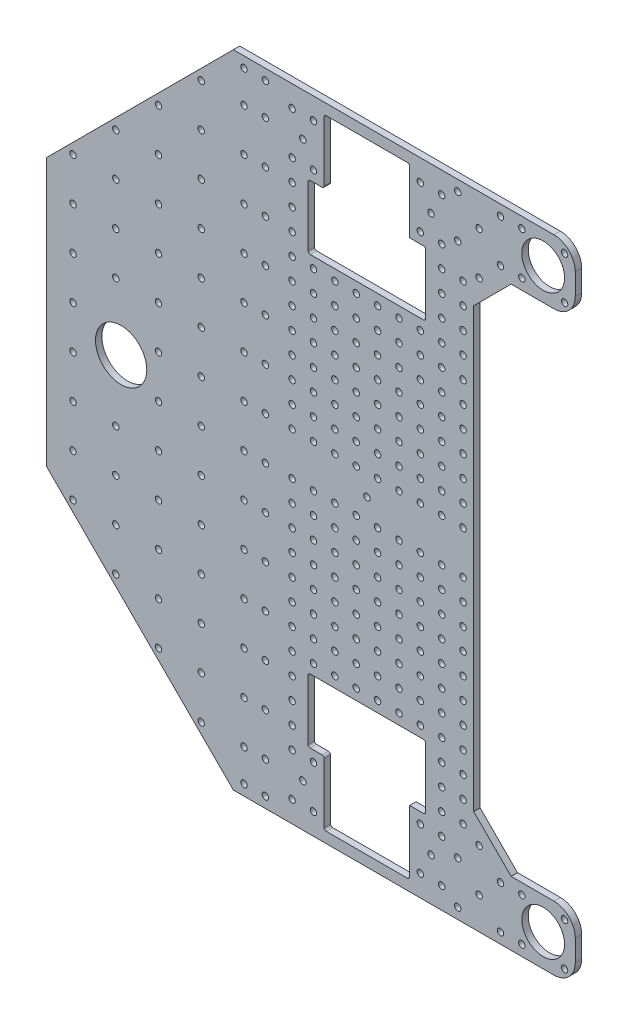
from build123d import *

# Parameters (mm, degrees)
SKETCH1_R                               = 1.5
MAIN_DEPTH                              = 3
SKETCH10_R                              = 1.5
MAINHOLES_DEPTH                         = 213.153246499
MOTORCODERLEFTHOLE_DEPTH                = 213.153246499
SKETCH8_R                               = 1.5
LINEARBALLFIXLEFT_DEPTH                 = 213.153246499
FILLET1_R                               = 1
SKETCH4_R                               = 1.5
BOTTOMLEFTHOLE_DEPTH                    = 213.153246499
LPATTERN1_COUNT                         = 5
LPATTERN1_PITCH                         = 20
SKETCH9_R                               = 1.5
CUT_EXTRUDE1_DEPTH                      = 213.153246499
BOTTOMLEFTHOLELPATTERN_COUNT            = 7
BOTTOMLEFTHOLELPATTERN_PITCH            = 20
BOTTOMLEFTHOLELPATTERN_COPY_1_SKETCH_R  = 1.5
BOTTOMLEFTHOLELPATTERN_COPY_1_DEPTH     = 213.153246499
BOTTOMLEFTHOLELPATTERN_COPY_2_SKETCH_R  = 1.5
BOTTOMLEFTHOLELPATTERN_COPY_2_DEPTH     = 213.153246499
BOTTOMLEFTHOLELPATTERN_COPY_3_SKETCH_R  = 1.5
BOTTOMLEFTHOLELPATTERN_COPY_3_DEPTH     = 213.153246499
BOTTOMLEFTHOLELPATTERN_COPY_4_SKETCH_R  = 1.5
BOTTOMLEFTHOLELPATTERN_COPY_4_DEPTH     = 213.153246499
BOTTOMLEFTHOLELPATTERN_COPY_5_SKETCH_R  = 1.5
BOTTOMLEFTHOLELPATTERN_COPY_5_DEPTH     = 213.153246499
BOTTOMLEFTHOLELPATTERN_COPY_6_SKETCH_R  = 1.5
BOTTOMLEFTHOLELPATTERN_COPY_6_DEPTH     = 213.153246499
BOTTOMLEFTHOLELPATTERN_COPY_7_SKETCH_R  = 1.5
BOTTOMLEFTHOLELPATTERN_COPY_7_DEPTH     = 213.153246499
BOTTOMLEFTHOLELPATTERN_COPY_8_SKETCH_R  = 1.5
BOTTOMLEFTHOLELPATTERN_COPY_8_DEPTH     = 213.153246499
BOTTOMLEFTHOLELPATTERN_COPY_9_SKETCH_R  = 1.5
BOTTOMLEFTHOLELPATTERN_COPY_9_DEPTH     = 213.153246499
BOTTOMLEFTHOLELPATTERN_COPY_10_SKETCH_R = 1.5
BOTTOMLEFTHOLELPATTERN_COPY_10_DEPTH    = 213.153246499
BOTTOMLEFTHOLELPATTERN_COPY_11_SKETCH_R = 1.5
BOTTOMLEFTHOLELPATTERN_COPY_11_DEPTH    = 213.153246499
BOTTOMLEFTHOLELPATTERN_COPY_12_SKETCH_R = 1.5
BOTTOMLEFTHOLELPATTERN_COPY_12_DEPTH    = 213.153246499
BOTTOMLEFTHOLELPATTERN_COPY_13_SKETCH_R = 1.5
BOTTOMLEFTHOLELPATTERN_COPY_13_DEPTH    = 213.153246499
BOTTOMLEFTHOLELPATTERN_COPY_14_SKETCH_R = 1.5
BOTTOMLEFTHOLELPATTERN_COPY_14_DEPTH    = 213.153246499
BOTTOMLEFTHOLELPATTERN_COPY_15_SKETCH_R = 1.5
BOTTOMLEFTHOLELPATTERN_COPY_15_DEPTH    = 213.153246499
BOTTOMLEFTHOLELPATTERN_COPY_16_SKETCH_R = 1.5
BOTTOMLEFTHOLELPATTERN_COPY_16_DEPTH    = 213.153246499
BOTTOMLEFTHOLELPATTERN_COPY_17_SKETCH_R = 1.5
BOTTOMLEFTHOLELPATTERN_COPY_17_DEPTH    = 213.153246499
BOTTOMLEFTHOLELPATTERN_COPY_18_SKETCH_R = 1.5
BOTTOMLEFTHOLELPATTERN_COPY_18_DEPTH    = 213.153246499
BOTTOMLEFTHOLELPATTERN_COPY_19_SKETCH_R = 1.5
BOTTOMLEFTHOLELPATTERN_COPY_19_DEPTH    = 213.153246499
BOTTOMLEFTHOLELPATTERN_COPY_20_SKETCH_R = 1.5
BOTTOMLEFTHOLELPATTERN_COPY_20_DEPTH    = 213.153246499
BOTTOMLEFTHOLELPATTERN_COPY_21_SKETCH_R = 1.5
BOTTOMLEFTHOLELPATTERN_COPY_21_DEPTH    = 213.153246499
BOTTOMLEFTHOLELPATTERN_COPY_22_SKETCH_R = 1.5
BOTTOMLEFTHOLELPATTERN_COPY_22_DEPTH    = 213.153246499
BOTTOMLEFTHOLELPATTERN_COPY_23_SKETCH_R = 1.5
BOTTOMLEFTHOLELPATTERN_COPY_23_DEPTH    = 213.153246499
BOTTOMLEFTHOLELPATTERN_COPY_24_SKETCH_R = 1.5
BOTTOMLEFTHOLELPATTERN_COPY_24_DEPTH    = 213.153246499
BOTTOMLEFTHOLELPATTERN_COPY_25_SKETCH_R = 1.5
BOTTOMLEFTHOLELPATTERN_COPY_25_DEPTH    = 213.153246499
BOTTOMLEFTHOLELPATTERN_COPY_26_SKETCH_R = 1.5
BOTTOMLEFTHOLELPATTERN_COPY_26_DEPTH    = 213.153246499
BOTTOMLEFTHOLELPATTERN_COPY_27_SKETCH_R = 1.5
BOTTOMLEFTHOLELPATTERN_COPY_27_DEPTH    = 213.153246499
BOTTOMLEFTHOLELPATTERN_COPY_28_SKETCH_R = 1.5
BOTTOMLEFTHOLELPATTERN_COPY_28_DEPTH    = 213.153246499
BOTTOMLEFTHOLELPATTERN_COPY_29_SKETCH_R = 1.5
BOTTOMLEFTHOLELPATTERN_COPY_29_DEPTH    = 213.153246499
BOTTOMLEFTHOLELPATTERN_COPY_30_SKETCH_R = 1.5
BOTTOMLEFTHOLELPATTERN_COPY_30_DEPTH    = 213.153246499
SKETCH7_R                               = 1.5
MOTORFIXHOLES_DEPTH                     = 213.153246499
MOTORFIXHOLELPATTERN_COUNT              = 11
MOTORFIXHOLELPATTERN_PITCH              = 10
SKETCH3_R                               = 12
SKETCH3_R_2                             = 10
BIGHOLES_DEPTH                          = 213.153246499
SKETCH5_R                               = 1.5
FRONTBALLSFIX_DEPTH                     = 213.153246499
MIRROR2_COPY_1_SKETCH_R                 = 1.5
MIRROR2_COPY_1_DEPTH                    = 213.153246499
MIRROR2_COPY_2_SKETCH_R                 = 1.5
MIRROR2_COPY_2_DEPTH                    = 213.153246499
MIRROR2_COPY_3_SKETCH_R                 = 1.5
MIRROR2_COPY_3_DEPTH                    = 213.153246499
MIRROR2_COPY_4_SKETCH_R                 = 1.5
MIRROR2_COPY_4_DEPTH                    = 213.153246499
MIRROR2_COPY_5_SKETCH_R                 = 1.5
MIRROR2_COPY_5_DEPTH                    = 213.153246499
MIRROR2_COPY_6_SKETCH_R                 = 1.5
MIRROR2_COPY_6_DEPTH                    = 213.153246499
MIRROR2_COPY_7_SKETCH_R                 = 1.5
MIRROR2_COPY_7_DEPTH                    = 213.153246499
MIRROR2_COPY_8_SKETCH_R                 = 1.5
MIRROR2_COPY_8_DEPTH                    = 213.153246499
MIRROR2_COPY_9_SKETCH_R                 = 1.5
MIRROR2_COPY_9_DEPTH                    = 213.153246499
MIRROR2_COPY_10_SKETCH_R                = 1.5
MIRROR2_COPY_10_DEPTH                   = 213.153246499
MIRROR2_COPY_11_SKETCH_R                = 1.5
MIRROR2_COPY_11_DEPTH                   = 213.153246499
MIRROR2_COPY_12_SKETCH_R                = 1.5
MIRROR2_COPY_12_DEPTH                   = 213.153246499
MIRROR2_COPY_13_SKETCH_R                = 1.5
MIRROR2_COPY_13_DEPTH                   = 213.153246499
MIRROR2_COPY_14_SKETCH_R                = 1.5
MIRROR2_COPY_14_DEPTH                   = 213.153246499
MIRROR2_COPY_15_SKETCH_R                = 1.5
MIRROR2_COPY_15_DEPTH                   = 213.153246499
MIRROR2_COPY_16_SKETCH_R                = 1.5
MIRROR2_COPY_16_DEPTH                   = 213.153246499
MIRROR2_COPY_17_SKETCH_R                = 1.5
MIRROR2_COPY_17_DEPTH                   = 213.153246499
MIRROR2_COPY_18_SKETCH_R                = 1.5
MIRROR2_COPY_18_DEPTH                   = 213.153246499
MIRROR2_COPY_19_SKETCH_R                = 1.5
MIRROR2_COPY_19_DEPTH                   = 213.153246499
MIRROR2_COPY_20_SKETCH_R                = 1.5
MIRROR2_COPY_20_DEPTH                   = 213.153246499
MIRROR2_COPY_21_SKETCH_R                = 1.5
MIRROR2_COPY_21_DEPTH                   = 213.153246499
MIRROR2_COPY_22_SKETCH_R                = 1.5
MIRROR2_COPY_22_DEPTH                   = 213.153246499
MIRROR2_COPY_23_SKETCH_R                = 1.5
MIRROR2_COPY_23_DEPTH                   = 213.153246499
MIRROR2_COPY_24_SKETCH_R                = 1.5
MIRROR2_COPY_24_DEPTH                   = 213.153246499
MIRROR2_COPY_25_SKETCH_R                = 1.5
MIRROR2_COPY_25_DEPTH                   = 213.153246499
MIRROR2_COPY_26_SKETCH_R                = 1.5
MIRROR2_COPY_26_DEPTH                   = 213.153246499
MIRROR2_COPY_27_SKETCH_R                = 1.5
MIRROR2_COPY_27_DEPTH                   = 213.153246499
MIRROR2_COPY_28_SKETCH_R                = 1.5
MIRROR2_COPY_28_DEPTH                   = 213.153246499
MIRROR2_COPY_29_SKETCH_R                = 1.5
MIRROR2_COPY_29_DEPTH                   = 213.153246499
MIRROR2_COPY_30_SKETCH_R                = 1.5
MIRROR2_COPY_30_DEPTH                   = 213.153246499
MIRROR2_COPY_31_SKETCH_R                = 1.5
MIRROR2_COPY_31_DEPTH                   = 213.153246499
MIRROR2_COPY_32_SKETCH_R                = 1.5
MIRROR2_COPY_32_DEPTH                   = 213.153246499
MIRROR2_COPY_33_SKETCH_R                = 1.5
MIRROR2_COPY_33_DEPTH                   = 213.153246499
MIRROR2_COPY_34_SKETCH_R                = 1.5
MIRROR2_COPY_34_DEPTH                   = 213.153246499
MIRROR2_COPY_35_SKETCH_R                = 1.5
MIRROR2_COPY_35_DEPTH                   = 213.153246499
MIRROR2_COPY_36_SKETCH_R                = 1.5
MIRROR2_COPY_36_DEPTH                   = 213.153246499
MIRROR2_COPY_37_SKETCH_R                = 1.5
MIRROR2_COPY_37_DEPTH                   = 213.153246499
MIRROR2_COPY_38_SKETCH_R                = 1.5
MIRROR2_COPY_38_DEPTH                   = 213.153246499
MIRROR2_COPY_39_SKETCH_R                = 1.5
MIRROR2_COPY_39_DEPTH                   = 213.153246499
MIRROR2_COPY_40_SKETCH_R                = 1.5
MIRROR2_COPY_40_DEPTH                   = 213.153246499
MIRROR2_COPY_41_SKETCH_R                = 1.5
MIRROR2_COPY_41_DEPTH                   = 213.153246499
MIRROR2_COPY_42_SKETCH_R                = 1.5
MIRROR2_COPY_42_DEPTH                   = 213.153246499
MIRROR2_COPY_43_SKETCH_R                = 1.5
MIRROR2_COPY_43_DEPTH                   = 213.153246499
MIRROR2_COPY_44_SKETCH_R                = 1.5
MIRROR2_COPY_44_DEPTH                   = 213.153246499
MIRROR2_COPY_45_SKETCH_R                = 1.5
MIRROR2_COPY_45_DEPTH                   = 213.153246499
MIRROR2_COPY_46_SKETCH_R                = 1.5
MIRROR2_COPY_46_DEPTH                   = 213.153246499
MIRROR2_COPY_47_SKETCH_R                = 1.5
MIRROR2_COPY_47_DEPTH                   = 213.153246499
MIRROR2_COPY_48_SKETCH_R                = 1.5
MIRROR2_COPY_48_DEPTH                   = 213.153246499
MIRROR2_COPY_49_SKETCH_R                = 1.5
MIRROR2_COPY_49_DEPTH                   = 213.153246499
MIRROR2_COPY_50_SKETCH_R                = 1.5
MIRROR2_COPY_50_DEPTH                   = 213.153246499
MIRROR2_COPY_51_SKETCH_R                = 1.5
MIRROR2_COPY_51_DEPTH                   = 213.153246499
FILLET1_OF_MIRROR2_R                    = 1


with BuildPart() as part:
    # Sketch1 → Main (new body)
    with BuildSketch(Plane.XY):
        with BuildLine():
            Line((-150, 62.5), (-150, -62.5))
            Line((-150, -62.5), (-62.5, -150))
            Line((-62.5, -150), (87.5, -150))
            ThreePointArc((87.5, -150), (94.571067812, -147.071067812), (97.5, -140))
            Line((97.5, -140), (97.5, -130))
            ThreePointArc((97.5, -130), (94.571067812, -122.928932188), (87.5, -120))
            Line((87.5, -120), (67.5, -120))
            Line((67.5, -120), (50, -102.5))
            Line((50, -102.5), (50, 102.5))
            Line((50, 102.5), (67.5, 120))
            Line((67.5, 120), (87.5, 120))
            ThreePointArc((87.5, 120), (94.571067812, 122.928932188), (97.5, 130))
            Line((97.5, 130), (97.5, 140))
            ThreePointArc((97.5, 140), (94.571067812, 147.071067812), (87.5, 150))
            Line((87.5, 150), (-62.5, 150))
            Line((-62.5, 150), (-150, 62.5))
        make_face()
        Circle(SKETCH1_R, mode=Mode.SUBTRACT)
    extrude(amount=MAIN_DEPTH)

    # Sketch10 → MainHoles (cut, through all)
    with BuildSketch(Plane.XY.offset(3)):
        with Locations((-57.5, 145)):
            Circle(SKETCH10_R)
        with Locations((-47.5, 145)):
            Circle(SKETCH10_R)
        with Locations((62.5, 145)):
            Circle(SKETCH10_R)
        with Locations((62.5, 125)):
            Circle(SKETCH10_R)
        with Locations((42.5, 145)):
            Circle(SKETCH10_R)
        with Locations((42.5, 125)):
            Circle(SKETCH10_R)
        with Locations((52.5, 135)):
            Circle(SKETCH10_R)
        with Locations((52.5, 115)):
            Circle(SKETCH10_R)
    mainholes = extrude(amount=-MAINHOLES_DEPTH, mode=Mode.SUBTRACT)

    # Sketch2 → MotorCoderLeftHole (cut, through all)
    with BuildSketch(Plane.XY.offset(3)):
        Polygon((-27.5, 115), (-27.5, 85), (27.5, 85), (27.5, 115), (20, 115), (20, 145), (-20, 145), (-20, 115), align=None)
    motorcoderlefthole = extrude(amount=-MOTORCODERLEFTHOLE_DEPTH, mode=Mode.SUBTRACT)

    # Sketch8 → LinearBallFixLeft (cut, through all)
    with BuildSketch(Plane.XY.offset(3)):
        with Locations((-30, 130)):
            Circle(SKETCH8_R)
        with Locations((-35, 120)):
            Circle(SKETCH8_R)
        with Locations((-25, 120)):
            Circle(SKETCH8_R)
        with Locations((-35, 140)):
            Circle(SKETCH8_R)
        with Locations((-25, 140)):
            Circle(SKETCH8_R)
    linearballfixleft = extrude(amount=-LINEARBALLFIXLEFT_DEPTH, mode=Mode.SUBTRACT)

    # LinearBallFixLeftMirror: LinearBallFixLeft across plane
    add(linearballfixleft.mirror(Plane(origin=(0, 0, 0), x_dir=(0, 0, 1), z_dir=(1, 0, 0))), mode=Mode.SUBTRACT)

    # Fillet1
    fillet1_edges = [part.edges().sort_by_distance(p)[0] for p in [
        (-20, 145, 1.5),
        (27.5, 115, 1.5),
        (20, 145, 1.5),
        (-20, 115, 1.5),
        (-27.5, 115, 1.5),
        (27.5, 85, 1.5),
        (-27.5, 85, 1.5),
    ]]
    fillet(fillet1_edges, radius=FILLET1_R)

    # Sketch4 → BottomLeftHole (cut, through all)
    with BuildSketch(Plane.XY.offset(3)):
        with Locations((-57.5, 10)):
            Circle(SKETCH4_R)
    bottomlefthole = extrude(amount=-BOTTOMLEFTHOLE_DEPTH, mode=Mode.SUBTRACT)

    # LPattern1: BottomLeftHole ×5
    with Locations(*[(-i * LPATTERN1_PITCH, 0, 0) for i in range(1, LPATTERN1_COUNT)]):
        add(bottomlefthole, mode=Mode.SUBTRACT)

    # Sketch9 → Cut-Extrude1 (cut, through all)
    with BuildSketch(Plane.XY.offset(3)):
        with Locations((-47.5, 10)):
            Circle(SKETCH9_R)
    cut_extrude1 = extrude(amount=-CUT_EXTRUDE1_DEPTH, mode=Mode.SUBTRACT)

    # BottomLeftHoleLPattern: Cut-Extrude1 ×7
    with Locations(*[(0, i * BOTTOMLEFTHOLELPATTERN_PITCH, 0) for i in range(1, BOTTOMLEFTHOLELPATTERN_COUNT)]):
        add(cut_extrude1, mode=Mode.SUBTRACT)

    # BottomLeftHoleLPattern copy 1 sketch → BottomLeftHoleLPattern copy 1 (cut, through all)
    with BuildSketch(Plane(origin=(-20, 20, 3), x_dir=(1, 0, 0), z_dir=(0, 0, 1))):
        with Locations((-57.5, 10)):
            Circle(BOTTOMLEFTHOLELPATTERN_COPY_1_SKETCH_R)
    extrude(amount=-BOTTOMLEFTHOLELPATTERN_COPY_1_DEPTH, mode=Mode.SUBTRACT)

    # BottomLeftHoleLPattern copy 2 sketch → BottomLeftHoleLPattern copy 2 (cut, through all)
    with BuildSketch(Plane(origin=(-20, 40, 3), x_dir=(1, 0, 0), z_dir=(0, 0, 1))):
        with Locations((-57.5, 10)):
            Circle(BOTTOMLEFTHOLELPATTERN_COPY_2_SKETCH_R)
    extrude(amount=-BOTTOMLEFTHOLELPATTERN_COPY_2_DEPTH, mode=Mode.SUBTRACT)

    # BottomLeftHoleLPattern copy 3 sketch → BottomLeftHoleLPattern copy 3 (cut, through all)
    with BuildSketch(Plane(origin=(-20, 60, 3), x_dir=(1, 0, 0), z_dir=(0, 0, 1))):
        with Locations((-57.5, 10)):
            Circle(BOTTOMLEFTHOLELPATTERN_COPY_3_SKETCH_R)
    extrude(amount=-BOTTOMLEFTHOLELPATTERN_COPY_3_DEPTH, mode=Mode.SUBTRACT)

    # BottomLeftHoleLPattern copy 4 sketch → BottomLeftHoleLPattern copy 4 (cut, through all)
    with BuildSketch(Plane(origin=(-20, 80, 3), x_dir=(1, 0, 0), z_dir=(0, 0, 1))):
        with Locations((-57.5, 10)):
            Circle(BOTTOMLEFTHOLELPATTERN_COPY_4_SKETCH_R)
    extrude(amount=-BOTTOMLEFTHOLELPATTERN_COPY_4_DEPTH, mode=Mode.SUBTRACT)

    # BottomLeftHoleLPattern copy 5 sketch → BottomLeftHoleLPattern copy 5 (cut, through all)
    with BuildSketch(Plane(origin=(-20, 100, 3), x_dir=(1, 0, 0), z_dir=(0, 0, 1))):
        with Locations((-57.5, 10)):
            Circle(BOTTOMLEFTHOLELPATTERN_COPY_5_SKETCH_R)
    extrude(amount=-BOTTOMLEFTHOLELPATTERN_COPY_5_DEPTH, mode=Mode.SUBTRACT)

    # BottomLeftHoleLPattern copy 6 sketch → BottomLeftHoleLPattern copy 6 (cut, through all)
    with BuildSketch(Plane(origin=(-20, 120, 3), x_dir=(1, 0, 0), z_dir=(0, 0, 1))):
        with Locations((-57.5, 10)):
            Circle(BOTTOMLEFTHOLELPATTERN_COPY_6_SKETCH_R)
    extrude(amount=-BOTTOMLEFTHOLELPATTERN_COPY_6_DEPTH, mode=Mode.SUBTRACT)

    # BottomLeftHoleLPattern copy 7 sketch → BottomLeftHoleLPattern copy 7 (cut, through all)
    with BuildSketch(Plane(origin=(-40, 20, 3), x_dir=(1, 0, 0), z_dir=(0, 0, 1))):
        with Locations((-57.5, 10)):
            Circle(BOTTOMLEFTHOLELPATTERN_COPY_7_SKETCH_R)
    extrude(amount=-BOTTOMLEFTHOLELPATTERN_COPY_7_DEPTH, mode=Mode.SUBTRACT)

    # BottomLeftHoleLPattern copy 8 sketch → BottomLeftHoleLPattern copy 8 (cut, through all)
    with BuildSketch(Plane(origin=(-40, 40, 3), x_dir=(1, 0, 0), z_dir=(0, 0, 1))):
        with Locations((-57.5, 10)):
            Circle(BOTTOMLEFTHOLELPATTERN_COPY_8_SKETCH_R)
    extrude(amount=-BOTTOMLEFTHOLELPATTERN_COPY_8_DEPTH, mode=Mode.SUBTRACT)

    # BottomLeftHoleLPattern copy 9 sketch → BottomLeftHoleLPattern copy 9 (cut, through all)
    with BuildSketch(Plane(origin=(-40, 60, 3), x_dir=(1, 0, 0), z_dir=(0, 0, 1))):
        with Locations((-57.5, 10)):
            Circle(BOTTOMLEFTHOLELPATTERN_COPY_9_SKETCH_R)
    extrude(amount=-BOTTOMLEFTHOLELPATTERN_COPY_9_DEPTH, mode=Mode.SUBTRACT)

    # BottomLeftHoleLPattern copy 10 sketch → BottomLeftHoleLPattern copy 10 (cut, through all)
    with BuildSketch(Plane(origin=(-40, 80, 3), x_dir=(1, 0, 0), z_dir=(0, 0, 1))):
        with Locations((-57.5, 10)):
            Circle(BOTTOMLEFTHOLELPATTERN_COPY_10_SKETCH_R)
    extrude(amount=-BOTTOMLEFTHOLELPATTERN_COPY_10_DEPTH, mode=Mode.SUBTRACT)

    # BottomLeftHoleLPattern copy 11 sketch → BottomLeftHoleLPattern copy 11 (cut, through all)
    with BuildSketch(Plane(origin=(-40, 100, 3), x_dir=(1, 0, 0), z_dir=(0, 0, 1))):
        with Locations((-57.5, 10)):
            Circle(BOTTOMLEFTHOLELPATTERN_COPY_11_SKETCH_R)
    extrude(amount=-BOTTOMLEFTHOLELPATTERN_COPY_11_DEPTH, mode=Mode.SUBTRACT)

    # BottomLeftHoleLPattern copy 12 sketch → BottomLeftHoleLPattern copy 12 (cut, through all)
    with BuildSketch(Plane(origin=(-40, 120, 3), x_dir=(1, 0, 0), z_dir=(0, 0, 1))):
        with Locations((-57.5, 10)):
            Circle(BOTTOMLEFTHOLELPATTERN_COPY_12_SKETCH_R)
    extrude(amount=-BOTTOMLEFTHOLELPATTERN_COPY_12_DEPTH, mode=Mode.SUBTRACT)

    # BottomLeftHoleLPattern copy 13 sketch → BottomLeftHoleLPattern copy 13 (cut, through all)
    with BuildSketch(Plane(origin=(-60, 20, 3), x_dir=(1, 0, 0), z_dir=(0, 0, 1))):
        with Locations((-57.5, 10)):
            Circle(BOTTOMLEFTHOLELPATTERN_COPY_13_SKETCH_R)
    extrude(amount=-BOTTOMLEFTHOLELPATTERN_COPY_13_DEPTH, mode=Mode.SUBTRACT)

    # BottomLeftHoleLPattern copy 14 sketch → BottomLeftHoleLPattern copy 14 (cut, through all)
    with BuildSketch(Plane(origin=(-60, 40, 3), x_dir=(1, 0, 0), z_dir=(0, 0, 1))):
        with Locations((-57.5, 10)):
            Circle(BOTTOMLEFTHOLELPATTERN_COPY_14_SKETCH_R)
    extrude(amount=-BOTTOMLEFTHOLELPATTERN_COPY_14_DEPTH, mode=Mode.SUBTRACT)

    # BottomLeftHoleLPattern copy 15 sketch → BottomLeftHoleLPattern copy 15 (cut, through all)
    with BuildSketch(Plane(origin=(-60, 60, 3), x_dir=(1, 0, 0), z_dir=(0, 0, 1))):
        with Locations((-57.5, 10)):
            Circle(BOTTOMLEFTHOLELPATTERN_COPY_15_SKETCH_R)
    extrude(amount=-BOTTOMLEFTHOLELPATTERN_COPY_15_DEPTH, mode=Mode.SUBTRACT)

    # BottomLeftHoleLPattern copy 16 sketch → BottomLeftHoleLPattern copy 16 (cut, through all)
    with BuildSketch(Plane(origin=(-60, 80, 3), x_dir=(1, 0, 0), z_dir=(0, 0, 1))):
        with Locations((-57.5, 10)):
            Circle(BOTTOMLEFTHOLELPATTERN_COPY_16_SKETCH_R)
    extrude(amount=-BOTTOMLEFTHOLELPATTERN_COPY_16_DEPTH, mode=Mode.SUBTRACT)

    # BottomLeftHoleLPattern copy 17 sketch → BottomLeftHoleLPattern copy 17 (cut, through all)
    with BuildSketch(Plane(origin=(-60, 100, 3), x_dir=(1, 0, 0), z_dir=(0, 0, 1))):
        with Locations((-57.5, 10)):
            Circle(BOTTOMLEFTHOLELPATTERN_COPY_17_SKETCH_R)
    extrude(amount=-BOTTOMLEFTHOLELPATTERN_COPY_17_DEPTH, mode=Mode.SUBTRACT)

    # BottomLeftHoleLPattern copy 18 sketch → BottomLeftHoleLPattern copy 18 (cut, through all)
    with BuildSketch(Plane(origin=(-60, 120, 3), x_dir=(1, 0, 0), z_dir=(0, 0, 1))):
        with Locations((-57.5, 10)):
            Circle(BOTTOMLEFTHOLELPATTERN_COPY_18_SKETCH_R)
    extrude(amount=-BOTTOMLEFTHOLELPATTERN_COPY_18_DEPTH, mode=Mode.SUBTRACT)

    # BottomLeftHoleLPattern copy 19 sketch → BottomLeftHoleLPattern copy 19 (cut, through all)
    with BuildSketch(Plane(origin=(-80, 20, 3), x_dir=(1, 0, 0), z_dir=(0, 0, 1))):
        with Locations((-57.5, 10)):
            Circle(BOTTOMLEFTHOLELPATTERN_COPY_19_SKETCH_R)
    extrude(amount=-BOTTOMLEFTHOLELPATTERN_COPY_19_DEPTH, mode=Mode.SUBTRACT)

    # BottomLeftHoleLPattern copy 20 sketch → BottomLeftHoleLPattern copy 20 (cut, through all)
    with BuildSketch(Plane(origin=(-80, 40, 3), x_dir=(1, 0, 0), z_dir=(0, 0, 1))):
        with Locations((-57.5, 10)):
            Circle(BOTTOMLEFTHOLELPATTERN_COPY_20_SKETCH_R)
    extrude(amount=-BOTTOMLEFTHOLELPATTERN_COPY_20_DEPTH, mode=Mode.SUBTRACT)

    # BottomLeftHoleLPattern copy 21 sketch → BottomLeftHoleLPattern copy 21 (cut, through all)
    with BuildSketch(Plane(origin=(-80, 60, 3), x_dir=(1, 0, 0), z_dir=(0, 0, 1))):
        with Locations((-57.5, 10)):
            Circle(BOTTOMLEFTHOLELPATTERN_COPY_21_SKETCH_R)
    extrude(amount=-BOTTOMLEFTHOLELPATTERN_COPY_21_DEPTH, mode=Mode.SUBTRACT)

    # BottomLeftHoleLPattern copy 22 sketch → BottomLeftHoleLPattern copy 22 (cut, through all)
    with BuildSketch(Plane(origin=(-80, 80, 3), x_dir=(1, 0, 0), z_dir=(0, 0, 1))):
        with Locations((-57.5, 10)):
            Circle(BOTTOMLEFTHOLELPATTERN_COPY_22_SKETCH_R)
    extrude(amount=-BOTTOMLEFTHOLELPATTERN_COPY_22_DEPTH, mode=Mode.SUBTRACT)

    # BottomLeftHoleLPattern copy 23 sketch → BottomLeftHoleLPattern copy 23 (cut, through all)
    with BuildSketch(Plane(origin=(-80, 100, 3), x_dir=(1, 0, 0), z_dir=(0, 0, 1))):
        with Locations((-57.5, 10)):
            Circle(BOTTOMLEFTHOLELPATTERN_COPY_23_SKETCH_R)
    extrude(amount=-BOTTOMLEFTHOLELPATTERN_COPY_23_DEPTH, mode=Mode.SUBTRACT)

    # BottomLeftHoleLPattern copy 24 sketch → BottomLeftHoleLPattern copy 24 (cut, through all)
    with BuildSketch(Plane(origin=(-80, 120, 3), x_dir=(1, 0, 0), z_dir=(0, 0, 1))):
        with Locations((-57.5, 10)):
            Circle(BOTTOMLEFTHOLELPATTERN_COPY_24_SKETCH_R)
    extrude(amount=-BOTTOMLEFTHOLELPATTERN_COPY_24_DEPTH, mode=Mode.SUBTRACT)

    # BottomLeftHoleLPattern copy 25 sketch → BottomLeftHoleLPattern copy 25 (cut, through all)
    with BuildSketch(Plane(origin=(0, 20, 3), x_dir=(1, 0, 0), z_dir=(0, 0, 1))):
        with Locations((-57.5, 10)):
            Circle(BOTTOMLEFTHOLELPATTERN_COPY_25_SKETCH_R)
    extrude(amount=-BOTTOMLEFTHOLELPATTERN_COPY_25_DEPTH, mode=Mode.SUBTRACT)

    # BottomLeftHoleLPattern copy 26 sketch → BottomLeftHoleLPattern copy 26 (cut, through all)
    with BuildSketch(Plane(origin=(0, 40, 3), x_dir=(1, 0, 0), z_dir=(0, 0, 1))):
        with Locations((-57.5, 10)):
            Circle(BOTTOMLEFTHOLELPATTERN_COPY_26_SKETCH_R)
    extrude(amount=-BOTTOMLEFTHOLELPATTERN_COPY_26_DEPTH, mode=Mode.SUBTRACT)

    # BottomLeftHoleLPattern copy 27 sketch → BottomLeftHoleLPattern copy 27 (cut, through all)
    with BuildSketch(Plane(origin=(0, 60, 3), x_dir=(1, 0, 0), z_dir=(0, 0, 1))):
        with Locations((-57.5, 10)):
            Circle(BOTTOMLEFTHOLELPATTERN_COPY_27_SKETCH_R)
    extrude(amount=-BOTTOMLEFTHOLELPATTERN_COPY_27_DEPTH, mode=Mode.SUBTRACT)

    # BottomLeftHoleLPattern copy 28 sketch → BottomLeftHoleLPattern copy 28 (cut, through all)
    with BuildSketch(Plane(origin=(0, 80, 3), x_dir=(1, 0, 0), z_dir=(0, 0, 1))):
        with Locations((-57.5, 10)):
            Circle(BOTTOMLEFTHOLELPATTERN_COPY_28_SKETCH_R)
    extrude(amount=-BOTTOMLEFTHOLELPATTERN_COPY_28_DEPTH, mode=Mode.SUBTRACT)

    # BottomLeftHoleLPattern copy 29 sketch → BottomLeftHoleLPattern copy 29 (cut, through all)
    with BuildSketch(Plane(origin=(0, 100, 3), x_dir=(1, 0, 0), z_dir=(0, 0, 1))):
        with Locations((-57.5, 10)):
            Circle(BOTTOMLEFTHOLELPATTERN_COPY_29_SKETCH_R)
    extrude(amount=-BOTTOMLEFTHOLELPATTERN_COPY_29_DEPTH, mode=Mode.SUBTRACT)

    # BottomLeftHoleLPattern copy 30 sketch → BottomLeftHoleLPattern copy 30 (cut, through all)
    with BuildSketch(Plane(origin=(0, 120, 3), x_dir=(1, 0, 0), z_dir=(0, 0, 1))):
        with Locations((-57.5, 10)):
            Circle(BOTTOMLEFTHOLELPATTERN_COPY_30_SKETCH_R)
    extrude(amount=-BOTTOMLEFTHOLELPATTERN_COPY_30_DEPTH, mode=Mode.SUBTRACT)

    # Sketch7 → MotorFixHoles (cut, through all)
    with BuildSketch(Plane.XY.offset(3)):
        with Locations((-5, 10)):
            Circle(SKETCH7_R)
        with Locations((-15, 10)):
            Circle(SKETCH7_R)
        with Locations((5, 10)):
            Circle(SKETCH7_R)
        with Locations((-25, 10)):
            Circle(SKETCH7_R)
        with Locations((15, 10)):
            Circle(SKETCH7_R)
        with Locations((-35, 10)):
            Circle(SKETCH7_R)
        with Locations((25, 10)):
            Circle(SKETCH7_R)
        with Locations((45, 10)):
            Circle(SKETCH7_R)
        with Locations((35, 10)):
            Circle(SKETCH7_R)
    motorfixholes = extrude(amount=-MOTORFIXHOLES_DEPTH, mode=Mode.SUBTRACT)

    # MotorFixHoleLPattern: MotorFixHoles ×11
    with Locations(*[(0, i * MOTORFIXHOLELPATTERN_PITCH, 0) for i in range(1, MOTORFIXHOLELPATTERN_COUNT)]):
        add(motorfixholes, mode=Mode.SUBTRACT)

    # Sketch3 → BigHoles (cut, through all)
    with BuildSketch(Plane.XY.offset(3)):
        with Locations((-115, 0)):
            Circle(SKETCH3_R)
        with Locations((82.5, 135)):
            Circle(SKETCH3_R_2)
        with Locations((82.5, -135)):
            Circle(SKETCH3_R_2)
    bigholes = extrude(amount=-BIGHOLES_DEPTH, mode=Mode.SUBTRACT)

    # Sketch5 → FrontBallsFix (cut, through all)
    with BuildSketch(Plane.XY.offset(3)):
        with Locations((72.5, 125)):
            Circle(SKETCH5_R)
        with Locations((92.5, 125)):
            Circle(SKETCH5_R)
        with Locations((72.5, 145)):
            Circle(SKETCH5_R)
        with Locations((92.5, 145)):
            Circle(SKETCH5_R)
    frontballsfix = extrude(amount=-FRONTBALLSFIX_DEPTH, mode=Mode.SUBTRACT)

    # Mirror2: MainHoles, MotorCoderLeftHole, LinearBallFixLeft, BottomLeftHole, Cut-Extrude1, MotorFixHoles, BigHoles, FrontBallsFix across plane
    add(mainholes.mirror(Plane.ZX), mode=Mode.SUBTRACT)
    add(motorcoderlefthole.mirror(Plane.ZX), mode=Mode.SUBTRACT)
    add(linearballfixleft.mirror(Plane.ZX), mode=Mode.SUBTRACT)
    add(bottomlefthole.mirror(Plane.ZX), mode=Mode.SUBTRACT)
    add(cut_extrude1.mirror(Plane.ZX), mode=Mode.SUBTRACT)
    add(motorfixholes.mirror(Plane.ZX), mode=Mode.SUBTRACT)
    add(bigholes.mirror(Plane.ZX), mode=Mode.SUBTRACT)
    add(frontballsfix.mirror(Plane.ZX), mode=Mode.SUBTRACT)

    # Mirror2 copy 1 sketch → Mirror2 copy 1 (cut, through all)
    with BuildSketch(Plane(origin=(0, 0, 3), x_dir=(-1, 0, 0), z_dir=(0, 0, 1))):
        with Locations((-30, 130)):
            Circle(MIRROR2_COPY_1_SKETCH_R)
        with Locations((-35, 120)):
            Circle(MIRROR2_COPY_1_SKETCH_R)
        with Locations((-25, 120)):
            Circle(MIRROR2_COPY_1_SKETCH_R)
        with Locations((-35, 140)):
            Circle(MIRROR2_COPY_1_SKETCH_R)
        with Locations((-25, 140)):
            Circle(MIRROR2_COPY_1_SKETCH_R)
    extrude(amount=-MIRROR2_COPY_1_DEPTH, mode=Mode.SUBTRACT)

    # Mirror2 copy 2 sketch → Mirror2 copy 2 (cut, through all)
    with BuildSketch(Plane(origin=(-20, 0, 3), x_dir=(1, 0, 0), z_dir=(0, 0, 1))):
        with Locations((-57.5, -10)):
            Circle(MIRROR2_COPY_2_SKETCH_R)
    extrude(amount=-MIRROR2_COPY_2_DEPTH, mode=Mode.SUBTRACT)

    # Mirror2 copy 3 sketch → Mirror2 copy 3 (cut, through all)
    with BuildSketch(Plane(origin=(-40, 0, 3), x_dir=(1, 0, 0), z_dir=(0, 0, 1))):
        with Locations((-57.5, -10)):
            Circle(MIRROR2_COPY_3_SKETCH_R)
    extrude(amount=-MIRROR2_COPY_3_DEPTH, mode=Mode.SUBTRACT)

    # Mirror2 copy 4 sketch → Mirror2 copy 4 (cut, through all)
    with BuildSketch(Plane(origin=(-60, 0, 3), x_dir=(1, 0, 0), z_dir=(0, 0, 1))):
        with Locations((-57.5, -10)):
            Circle(MIRROR2_COPY_4_SKETCH_R)
    extrude(amount=-MIRROR2_COPY_4_DEPTH, mode=Mode.SUBTRACT)

    # Mirror2 copy 5 sketch → Mirror2 copy 5 (cut, through all)
    with BuildSketch(Plane(origin=(-80, 0, 3), x_dir=(1, 0, 0), z_dir=(0, 0, 1))):
        with Locations((-57.5, -10)):
            Circle(MIRROR2_COPY_5_SKETCH_R)
    extrude(amount=-MIRROR2_COPY_5_DEPTH, mode=Mode.SUBTRACT)

    # Mirror2 copy 6 sketch → Mirror2 copy 6 (cut, through all)
    with BuildSketch(Plane(origin=(0, -20, 3), x_dir=(1, 0, 0), z_dir=(0, 0, 1))):
        with Locations((-47.5, -10)):
            Circle(MIRROR2_COPY_6_SKETCH_R)
    extrude(amount=-MIRROR2_COPY_6_DEPTH, mode=Mode.SUBTRACT)

    # Mirror2 copy 7 sketch → Mirror2 copy 7 (cut, through all)
    with BuildSketch(Plane(origin=(0, -40, 3), x_dir=(1, 0, 0), z_dir=(0, 0, 1))):
        with Locations((-47.5, -10)):
            Circle(MIRROR2_COPY_7_SKETCH_R)
    extrude(amount=-MIRROR2_COPY_7_DEPTH, mode=Mode.SUBTRACT)

    # Mirror2 copy 8 sketch → Mirror2 copy 8 (cut, through all)
    with BuildSketch(Plane(origin=(0, -60, 3), x_dir=(1, 0, 0), z_dir=(0, 0, 1))):
        with Locations((-47.5, -10)):
            Circle(MIRROR2_COPY_8_SKETCH_R)
    extrude(amount=-MIRROR2_COPY_8_DEPTH, mode=Mode.SUBTRACT)

    # Mirror2 copy 9 sketch → Mirror2 copy 9 (cut, through all)
    with BuildSketch(Plane(origin=(0, -80, 3), x_dir=(1, 0, 0), z_dir=(0, 0, 1))):
        with Locations((-47.5, -10)):
            Circle(MIRROR2_COPY_9_SKETCH_R)
    extrude(amount=-MIRROR2_COPY_9_DEPTH, mode=Mode.SUBTRACT)

    # Mirror2 copy 10 sketch → Mirror2 copy 10 (cut, through all)
    with BuildSketch(Plane(origin=(0, -100, 3), x_dir=(1, 0, 0), z_dir=(0, 0, 1))):
        with Locations((-47.5, -10)):
            Circle(MIRROR2_COPY_10_SKETCH_R)
    extrude(amount=-MIRROR2_COPY_10_DEPTH, mode=Mode.SUBTRACT)

    # Mirror2 copy 11 sketch → Mirror2 copy 11 (cut, through all)
    with BuildSketch(Plane(origin=(0, -120, 3), x_dir=(1, 0, 0), z_dir=(0, 0, 1))):
        with Locations((-47.5, -10)):
            Circle(MIRROR2_COPY_11_SKETCH_R)
    extrude(amount=-MIRROR2_COPY_11_DEPTH, mode=Mode.SUBTRACT)

    # Mirror2 copy 12 sketch → Mirror2 copy 12 (cut, through all)
    with BuildSketch(Plane(origin=(-20, -20, 3), x_dir=(1, 0, 0), z_dir=(0, 0, 1))):
        with Locations((-57.5, -10)):
            Circle(MIRROR2_COPY_12_SKETCH_R)
    extrude(amount=-MIRROR2_COPY_12_DEPTH, mode=Mode.SUBTRACT)

    # Mirror2 copy 13 sketch → Mirror2 copy 13 (cut, through all)
    with BuildSketch(Plane(origin=(-20, -40, 3), x_dir=(1, 0, 0), z_dir=(0, 0, 1))):
        with Locations((-57.5, -10)):
            Circle(MIRROR2_COPY_13_SKETCH_R)
    extrude(amount=-MIRROR2_COPY_13_DEPTH, mode=Mode.SUBTRACT)

    # Mirror2 copy 14 sketch → Mirror2 copy 14 (cut, through all)
    with BuildSketch(Plane(origin=(-20, -60, 3), x_dir=(1, 0, 0), z_dir=(0, 0, 1))):
        with Locations((-57.5, -10)):
            Circle(MIRROR2_COPY_14_SKETCH_R)
    extrude(amount=-MIRROR2_COPY_14_DEPTH, mode=Mode.SUBTRACT)

    # Mirror2 copy 15 sketch → Mirror2 copy 15 (cut, through all)
    with BuildSketch(Plane(origin=(-20, -80, 3), x_dir=(1, 0, 0), z_dir=(0, 0, 1))):
        with Locations((-57.5, -10)):
            Circle(MIRROR2_COPY_15_SKETCH_R)
    extrude(amount=-MIRROR2_COPY_15_DEPTH, mode=Mode.SUBTRACT)

    # Mirror2 copy 16 sketch → Mirror2 copy 16 (cut, through all)
    with BuildSketch(Plane(origin=(-20, -100, 3), x_dir=(1, 0, 0), z_dir=(0, 0, 1))):
        with Locations((-57.5, -10)):
            Circle(MIRROR2_COPY_16_SKETCH_R)
    extrude(amount=-MIRROR2_COPY_16_DEPTH, mode=Mode.SUBTRACT)

    # Mirror2 copy 17 sketch → Mirror2 copy 17 (cut, through all)
    with BuildSketch(Plane(origin=(-20, -120, 3), x_dir=(1, 0, 0), z_dir=(0, 0, 1))):
        with Locations((-57.5, -10)):
            Circle(MIRROR2_COPY_17_SKETCH_R)
    extrude(amount=-MIRROR2_COPY_17_DEPTH, mode=Mode.SUBTRACT)

    # Mirror2 copy 18 sketch → Mirror2 copy 18 (cut, through all)
    with BuildSketch(Plane(origin=(-40, -20, 3), x_dir=(1, 0, 0), z_dir=(0, 0, 1))):
        with Locations((-57.5, -10)):
            Circle(MIRROR2_COPY_18_SKETCH_R)
    extrude(amount=-MIRROR2_COPY_18_DEPTH, mode=Mode.SUBTRACT)

    # Mirror2 copy 19 sketch → Mirror2 copy 19 (cut, through all)
    with BuildSketch(Plane(origin=(-40, -40, 3), x_dir=(1, 0, 0), z_dir=(0, 0, 1))):
        with Locations((-57.5, -10)):
            Circle(MIRROR2_COPY_19_SKETCH_R)
    extrude(amount=-MIRROR2_COPY_19_DEPTH, mode=Mode.SUBTRACT)

    # Mirror2 copy 20 sketch → Mirror2 copy 20 (cut, through all)
    with BuildSketch(Plane(origin=(-40, -60, 3), x_dir=(1, 0, 0), z_dir=(0, 0, 1))):
        with Locations((-57.5, -10)):
            Circle(MIRROR2_COPY_20_SKETCH_R)
    extrude(amount=-MIRROR2_COPY_20_DEPTH, mode=Mode.SUBTRACT)

    # Mirror2 copy 21 sketch → Mirror2 copy 21 (cut, through all)
    with BuildSketch(Plane(origin=(-40, -80, 3), x_dir=(1, 0, 0), z_dir=(0, 0, 1))):
        with Locations((-57.5, -10)):
            Circle(MIRROR2_COPY_21_SKETCH_R)
    extrude(amount=-MIRROR2_COPY_21_DEPTH, mode=Mode.SUBTRACT)

    # Mirror2 copy 22 sketch → Mirror2 copy 22 (cut, through all)
    with BuildSketch(Plane(origin=(-40, -100, 3), x_dir=(1, 0, 0), z_dir=(0, 0, 1))):
        with Locations((-57.5, -10)):
            Circle(MIRROR2_COPY_22_SKETCH_R)
    extrude(amount=-MIRROR2_COPY_22_DEPTH, mode=Mode.SUBTRACT)

    # Mirror2 copy 23 sketch → Mirror2 copy 23 (cut, through all)
    with BuildSketch(Plane(origin=(-40, -120, 3), x_dir=(1, 0, 0), z_dir=(0, 0, 1))):
        with Locations((-57.5, -10)):
            Circle(MIRROR2_COPY_23_SKETCH_R)
    extrude(amount=-MIRROR2_COPY_23_DEPTH, mode=Mode.SUBTRACT)

    # Mirror2 copy 24 sketch → Mirror2 copy 24 (cut, through all)
    with BuildSketch(Plane(origin=(-60, -20, 3), x_dir=(1, 0, 0), z_dir=(0, 0, 1))):
        with Locations((-57.5, -10)):
            Circle(MIRROR2_COPY_24_SKETCH_R)
    extrude(amount=-MIRROR2_COPY_24_DEPTH, mode=Mode.SUBTRACT)

    # Mirror2 copy 25 sketch → Mirror2 copy 25 (cut, through all)
    with BuildSketch(Plane(origin=(-60, -40, 3), x_dir=(1, 0, 0), z_dir=(0, 0, 1))):
        with Locations((-57.5, -10)):
            Circle(MIRROR2_COPY_25_SKETCH_R)
    extrude(amount=-MIRROR2_COPY_25_DEPTH, mode=Mode.SUBTRACT)

    # Mirror2 copy 26 sketch → Mirror2 copy 26 (cut, through all)
    with BuildSketch(Plane(origin=(-60, -60, 3), x_dir=(1, 0, 0), z_dir=(0, 0, 1))):
        with Locations((-57.5, -10)):
            Circle(MIRROR2_COPY_26_SKETCH_R)
    extrude(amount=-MIRROR2_COPY_26_DEPTH, mode=Mode.SUBTRACT)

    # Mirror2 copy 27 sketch → Mirror2 copy 27 (cut, through all)
    with BuildSketch(Plane(origin=(-60, -80, 3), x_dir=(1, 0, 0), z_dir=(0, 0, 1))):
        with Locations((-57.5, -10)):
            Circle(MIRROR2_COPY_27_SKETCH_R)
    extrude(amount=-MIRROR2_COPY_27_DEPTH, mode=Mode.SUBTRACT)

    # Mirror2 copy 28 sketch → Mirror2 copy 28 (cut, through all)
    with BuildSketch(Plane(origin=(-60, -100, 3), x_dir=(1, 0, 0), z_dir=(0, 0, 1))):
        with Locations((-57.5, -10)):
            Circle(MIRROR2_COPY_28_SKETCH_R)
    extrude(amount=-MIRROR2_COPY_28_DEPTH, mode=Mode.SUBTRACT)

    # Mirror2 copy 29 sketch → Mirror2 copy 29 (cut, through all)
    with BuildSketch(Plane(origin=(-60, -120, 3), x_dir=(1, 0, 0), z_dir=(0, 0, 1))):
        with Locations((-57.5, -10)):
            Circle(MIRROR2_COPY_29_SKETCH_R)
    extrude(amount=-MIRROR2_COPY_29_DEPTH, mode=Mode.SUBTRACT)

    # Mirror2 copy 30 sketch → Mirror2 copy 30 (cut, through all)
    with BuildSketch(Plane(origin=(-80, -20, 3), x_dir=(1, 0, 0), z_dir=(0, 0, 1))):
        with Locations((-57.5, -10)):
            Circle(MIRROR2_COPY_30_SKETCH_R)
    extrude(amount=-MIRROR2_COPY_30_DEPTH, mode=Mode.SUBTRACT)

    # Mirror2 copy 31 sketch → Mirror2 copy 31 (cut, through all)
    with BuildSketch(Plane(origin=(-80, -40, 3), x_dir=(1, 0, 0), z_dir=(0, 0, 1))):
        with Locations((-57.5, -10)):
            Circle(MIRROR2_COPY_31_SKETCH_R)
    extrude(amount=-MIRROR2_COPY_31_DEPTH, mode=Mode.SUBTRACT)

    # Mirror2 copy 32 sketch → Mirror2 copy 32 (cut, through all)
    with BuildSketch(Plane(origin=(-80, -60, 3), x_dir=(1, 0, 0), z_dir=(0, 0, 1))):
        with Locations((-57.5, -10)):
            Circle(MIRROR2_COPY_32_SKETCH_R)
    extrude(amount=-MIRROR2_COPY_32_DEPTH, mode=Mode.SUBTRACT)

    # Mirror2 copy 33 sketch → Mirror2 copy 33 (cut, through all)
    with BuildSketch(Plane(origin=(-80, -80, 3), x_dir=(1, 0, 0), z_dir=(0, 0, 1))):
        with Locations((-57.5, -10)):
            Circle(MIRROR2_COPY_33_SKETCH_R)
    extrude(amount=-MIRROR2_COPY_33_DEPTH, mode=Mode.SUBTRACT)

    # Mirror2 copy 34 sketch → Mirror2 copy 34 (cut, through all)
    with BuildSketch(Plane(origin=(-80, -100, 3), x_dir=(1, 0, 0), z_dir=(0, 0, 1))):
        with Locations((-57.5, -10)):
            Circle(MIRROR2_COPY_34_SKETCH_R)
    extrude(amount=-MIRROR2_COPY_34_DEPTH, mode=Mode.SUBTRACT)

    # Mirror2 copy 35 sketch → Mirror2 copy 35 (cut, through all)
    with BuildSketch(Plane(origin=(-80, -120, 3), x_dir=(1, 0, 0), z_dir=(0, 0, 1))):
        with Locations((-57.5, -10)):
            Circle(MIRROR2_COPY_35_SKETCH_R)
    extrude(amount=-MIRROR2_COPY_35_DEPTH, mode=Mode.SUBTRACT)

    # Mirror2 copy 36 sketch → Mirror2 copy 36 (cut, through all)
    with BuildSketch(Plane(origin=(0, -20, 3), x_dir=(1, 0, 0), z_dir=(0, 0, 1))):
        with Locations((-57.5, -10)):
            Circle(MIRROR2_COPY_36_SKETCH_R)
    extrude(amount=-MIRROR2_COPY_36_DEPTH, mode=Mode.SUBTRACT)

    # Mirror2 copy 37 sketch → Mirror2 copy 37 (cut, through all)
    with BuildSketch(Plane(origin=(0, -40, 3), x_dir=(1, 0, 0), z_dir=(0, 0, 1))):
        with Locations((-57.5, -10)):
            Circle(MIRROR2_COPY_37_SKETCH_R)
    extrude(amount=-MIRROR2_COPY_37_DEPTH, mode=Mode.SUBTRACT)

    # Mirror2 copy 38 sketch → Mirror2 copy 38 (cut, through all)
    with BuildSketch(Plane(origin=(0, -60, 3), x_dir=(1, 0, 0), z_dir=(0, 0, 1))):
        with Locations((-57.5, -10)):
            Circle(MIRROR2_COPY_38_SKETCH_R)
    extrude(amount=-MIRROR2_COPY_38_DEPTH, mode=Mode.SUBTRACT)

    # Mirror2 copy 39 sketch → Mirror2 copy 39 (cut, through all)
    with BuildSketch(Plane(origin=(0, -80, 3), x_dir=(1, 0, 0), z_dir=(0, 0, 1))):
        with Locations((-57.5, -10)):
            Circle(MIRROR2_COPY_39_SKETCH_R)
    extrude(amount=-MIRROR2_COPY_39_DEPTH, mode=Mode.SUBTRACT)

    # Mirror2 copy 40 sketch → Mirror2 copy 40 (cut, through all)
    with BuildSketch(Plane(origin=(0, -100, 3), x_dir=(1, 0, 0), z_dir=(0, 0, 1))):
        with Locations((-57.5, -10)):
            Circle(MIRROR2_COPY_40_SKETCH_R)
    extrude(amount=-MIRROR2_COPY_40_DEPTH, mode=Mode.SUBTRACT)

    # Mirror2 copy 41 sketch → Mirror2 copy 41 (cut, through all)
    with BuildSketch(Plane(origin=(0, -120, 3), x_dir=(1, 0, 0), z_dir=(0, 0, 1))):
        with Locations((-57.5, -10)):
            Circle(MIRROR2_COPY_41_SKETCH_R)
    extrude(amount=-MIRROR2_COPY_41_DEPTH, mode=Mode.SUBTRACT)

    # Mirror2 copy 42 sketch → Mirror2 copy 42 (cut, through all)
    with BuildSketch(Plane(origin=(0, -10, 3), x_dir=(1, 0, 0), z_dir=(0, 0, 1))):
        with Locations((-5, -10)):
            Circle(MIRROR2_COPY_42_SKETCH_R)
        with Locations((-15, -10)):
            Circle(MIRROR2_COPY_42_SKETCH_R)
        with Locations((5, -10)):
            Circle(MIRROR2_COPY_42_SKETCH_R)
        with Locations((-25, -10)):
            Circle(MIRROR2_COPY_42_SKETCH_R)
        with Locations((15, -10)):
            Circle(MIRROR2_COPY_42_SKETCH_R)
        with Locations((-35, -10)):
            Circle(MIRROR2_COPY_42_SKETCH_R)
        with Locations((25, -10)):
            Circle(MIRROR2_COPY_42_SKETCH_R)
        with Locations((45, -10)):
            Circle(MIRROR2_COPY_42_SKETCH_R)
        with Locations((35, -10)):
            Circle(MIRROR2_COPY_42_SKETCH_R)
    extrude(amount=-MIRROR2_COPY_42_DEPTH, mode=Mode.SUBTRACT)

    # Mirror2 copy 43 sketch → Mirror2 copy 43 (cut, through all)
    with BuildSketch(Plane(origin=(0, -20, 3), x_dir=(1, 0, 0), z_dir=(0, 0, 1))):
        with Locations((-5, -10)):
            Circle(MIRROR2_COPY_43_SKETCH_R)
        with Locations((-15, -10)):
            Circle(MIRROR2_COPY_43_SKETCH_R)
        with Locations((5, -10)):
            Circle(MIRROR2_COPY_43_SKETCH_R)
        with Locations((-25, -10)):
            Circle(MIRROR2_COPY_43_SKETCH_R)
        with Locations((15, -10)):
            Circle(MIRROR2_COPY_43_SKETCH_R)
        with Locations((-35, -10)):
            Circle(MIRROR2_COPY_43_SKETCH_R)
        with Locations((25, -10)):
            Circle(MIRROR2_COPY_43_SKETCH_R)
        with Locations((45, -10)):
            Circle(MIRROR2_COPY_43_SKETCH_R)
        with Locations((35, -10)):
            Circle(MIRROR2_COPY_43_SKETCH_R)
    extrude(amount=-MIRROR2_COPY_43_DEPTH, mode=Mode.SUBTRACT)

    # Mirror2 copy 44 sketch → Mirror2 copy 44 (cut, through all)
    with BuildSketch(Plane(origin=(0, -30, 3), x_dir=(1, 0, 0), z_dir=(0, 0, 1))):
        with Locations((-5, -10)):
            Circle(MIRROR2_COPY_44_SKETCH_R)
        with Locations((-15, -10)):
            Circle(MIRROR2_COPY_44_SKETCH_R)
        with Locations((5, -10)):
            Circle(MIRROR2_COPY_44_SKETCH_R)
        with Locations((-25, -10)):
            Circle(MIRROR2_COPY_44_SKETCH_R)
        with Locations((15, -10)):
            Circle(MIRROR2_COPY_44_SKETCH_R)
        with Locations((-35, -10)):
            Circle(MIRROR2_COPY_44_SKETCH_R)
        with Locations((25, -10)):
            Circle(MIRROR2_COPY_44_SKETCH_R)
        with Locations((45, -10)):
            Circle(MIRROR2_COPY_44_SKETCH_R)
        with Locations((35, -10)):
            Circle(MIRROR2_COPY_44_SKETCH_R)
    extrude(amount=-MIRROR2_COPY_44_DEPTH, mode=Mode.SUBTRACT)

    # Mirror2 copy 45 sketch → Mirror2 copy 45 (cut, through all)
    with BuildSketch(Plane(origin=(0, -40, 3), x_dir=(1, 0, 0), z_dir=(0, 0, 1))):
        with Locations((-5, -10)):
            Circle(MIRROR2_COPY_45_SKETCH_R)
        with Locations((-15, -10)):
            Circle(MIRROR2_COPY_45_SKETCH_R)
        with Locations((5, -10)):
            Circle(MIRROR2_COPY_45_SKETCH_R)
        with Locations((-25, -10)):
            Circle(MIRROR2_COPY_45_SKETCH_R)
        with Locations((15, -10)):
            Circle(MIRROR2_COPY_45_SKETCH_R)
        with Locations((-35, -10)):
            Circle(MIRROR2_COPY_45_SKETCH_R)
        with Locations((25, -10)):
            Circle(MIRROR2_COPY_45_SKETCH_R)
        with Locations((45, -10)):
            Circle(MIRROR2_COPY_45_SKETCH_R)
        with Locations((35, -10)):
            Circle(MIRROR2_COPY_45_SKETCH_R)
    extrude(amount=-MIRROR2_COPY_45_DEPTH, mode=Mode.SUBTRACT)

    # Mirror2 copy 46 sketch → Mirror2 copy 46 (cut, through all)
    with BuildSketch(Plane(origin=(0, -50, 3), x_dir=(1, 0, 0), z_dir=(0, 0, 1))):
        with Locations((-5, -10)):
            Circle(MIRROR2_COPY_46_SKETCH_R)
        with Locations((-15, -10)):
            Circle(MIRROR2_COPY_46_SKETCH_R)
        with Locations((5, -10)):
            Circle(MIRROR2_COPY_46_SKETCH_R)
        with Locations((-25, -10)):
            Circle(MIRROR2_COPY_46_SKETCH_R)
        with Locations((15, -10)):
            Circle(MIRROR2_COPY_46_SKETCH_R)
        with Locations((-35, -10)):
            Circle(MIRROR2_COPY_46_SKETCH_R)
        with Locations((25, -10)):
            Circle(MIRROR2_COPY_46_SKETCH_R)
        with Locations((45, -10)):
            Circle(MIRROR2_COPY_46_SKETCH_R)
        with Locations((35, -10)):
            Circle(MIRROR2_COPY_46_SKETCH_R)
    extrude(amount=-MIRROR2_COPY_46_DEPTH, mode=Mode.SUBTRACT)

    # Mirror2 copy 47 sketch → Mirror2 copy 47 (cut, through all)
    with BuildSketch(Plane(origin=(0, -60, 3), x_dir=(1, 0, 0), z_dir=(0, 0, 1))):
        with Locations((-5, -10)):
            Circle(MIRROR2_COPY_47_SKETCH_R)
        with Locations((-15, -10)):
            Circle(MIRROR2_COPY_47_SKETCH_R)
        with Locations((5, -10)):
            Circle(MIRROR2_COPY_47_SKETCH_R)
        with Locations((-25, -10)):
            Circle(MIRROR2_COPY_47_SKETCH_R)
        with Locations((15, -10)):
            Circle(MIRROR2_COPY_47_SKETCH_R)
        with Locations((-35, -10)):
            Circle(MIRROR2_COPY_47_SKETCH_R)
        with Locations((25, -10)):
            Circle(MIRROR2_COPY_47_SKETCH_R)
        with Locations((45, -10)):
            Circle(MIRROR2_COPY_47_SKETCH_R)
        with Locations((35, -10)):
            Circle(MIRROR2_COPY_47_SKETCH_R)
    extrude(amount=-MIRROR2_COPY_47_DEPTH, mode=Mode.SUBTRACT)

    # Mirror2 copy 48 sketch → Mirror2 copy 48 (cut, through all)
    with BuildSketch(Plane(origin=(0, -70, 3), x_dir=(1, 0, 0), z_dir=(0, 0, 1))):
        with Locations((-5, -10)):
            Circle(MIRROR2_COPY_48_SKETCH_R)
        with Locations((-15, -10)):
            Circle(MIRROR2_COPY_48_SKETCH_R)
        with Locations((5, -10)):
            Circle(MIRROR2_COPY_48_SKETCH_R)
        with Locations((-25, -10)):
            Circle(MIRROR2_COPY_48_SKETCH_R)
        with Locations((15, -10)):
            Circle(MIRROR2_COPY_48_SKETCH_R)
        with Locations((-35, -10)):
            Circle(MIRROR2_COPY_48_SKETCH_R)
        with Locations((25, -10)):
            Circle(MIRROR2_COPY_48_SKETCH_R)
        with Locations((45, -10)):
            Circle(MIRROR2_COPY_48_SKETCH_R)
        with Locations((35, -10)):
            Circle(MIRROR2_COPY_48_SKETCH_R)
    extrude(amount=-MIRROR2_COPY_48_DEPTH, mode=Mode.SUBTRACT)

    # Mirror2 copy 49 sketch → Mirror2 copy 49 (cut, through all)
    with BuildSketch(Plane(origin=(0, -80, 3), x_dir=(1, 0, 0), z_dir=(0, 0, 1))):
        with Locations((-5, -10)):
            Circle(MIRROR2_COPY_49_SKETCH_R)
        with Locations((-15, -10)):
            Circle(MIRROR2_COPY_49_SKETCH_R)
        with Locations((5, -10)):
            Circle(MIRROR2_COPY_49_SKETCH_R)
        with Locations((-25, -10)):
            Circle(MIRROR2_COPY_49_SKETCH_R)
        with Locations((15, -10)):
            Circle(MIRROR2_COPY_49_SKETCH_R)
        with Locations((-35, -10)):
            Circle(MIRROR2_COPY_49_SKETCH_R)
        with Locations((25, -10)):
            Circle(MIRROR2_COPY_49_SKETCH_R)
        with Locations((45, -10)):
            Circle(MIRROR2_COPY_49_SKETCH_R)
        with Locations((35, -10)):
            Circle(MIRROR2_COPY_49_SKETCH_R)
    extrude(amount=-MIRROR2_COPY_49_DEPTH, mode=Mode.SUBTRACT)

    # Mirror2 copy 50 sketch → Mirror2 copy 50 (cut, through all)
    with BuildSketch(Plane(origin=(0, -90, 3), x_dir=(1, 0, 0), z_dir=(0, 0, 1))):
        with Locations((-5, -10)):
            Circle(MIRROR2_COPY_50_SKETCH_R)
        with Locations((-15, -10)):
            Circle(MIRROR2_COPY_50_SKETCH_R)
        with Locations((5, -10)):
            Circle(MIRROR2_COPY_50_SKETCH_R)
        with Locations((-25, -10)):
            Circle(MIRROR2_COPY_50_SKETCH_R)
        with Locations((15, -10)):
            Circle(MIRROR2_COPY_50_SKETCH_R)
        with Locations((-35, -10)):
            Circle(MIRROR2_COPY_50_SKETCH_R)
        with Locations((25, -10)):
            Circle(MIRROR2_COPY_50_SKETCH_R)
        with Locations((45, -10)):
            Circle(MIRROR2_COPY_50_SKETCH_R)
        with Locations((35, -10)):
            Circle(MIRROR2_COPY_50_SKETCH_R)
    extrude(amount=-MIRROR2_COPY_50_DEPTH, mode=Mode.SUBTRACT)

    # Mirror2 copy 51 sketch → Mirror2 copy 51 (cut, through all)
    with BuildSketch(Plane(origin=(0, -100, 3), x_dir=(1, 0, 0), z_dir=(0, 0, 1))):
        with Locations((-5, -10)):
            Circle(MIRROR2_COPY_51_SKETCH_R)
        with Locations((-15, -10)):
            Circle(MIRROR2_COPY_51_SKETCH_R)
        with Locations((5, -10)):
            Circle(MIRROR2_COPY_51_SKETCH_R)
        with Locations((-25, -10)):
            Circle(MIRROR2_COPY_51_SKETCH_R)
        with Locations((15, -10)):
            Circle(MIRROR2_COPY_51_SKETCH_R)
        with Locations((-35, -10)):
            Circle(MIRROR2_COPY_51_SKETCH_R)
        with Locations((25, -10)):
            Circle(MIRROR2_COPY_51_SKETCH_R)
        with Locations((45, -10)):
            Circle(MIRROR2_COPY_51_SKETCH_R)
        with Locations((35, -10)):
            Circle(MIRROR2_COPY_51_SKETCH_R)
    extrude(amount=-MIRROR2_COPY_51_DEPTH, mode=Mode.SUBTRACT)

    # Fillet1 of Mirror2
    fillet1_of_mirror2_edges = [part.edges().sort_by_distance(p)[0] for p in [
        (-20, -145, 1.5),
        (27.5, -115, 1.5),
        (20, -145, 1.5),
        (-20, -115, 1.5),
        (-27.5, -115, 1.5),
        (27.5, -85, 1.5),
        (-27.5, -85, 1.5),
    ]]
    fillet(fillet1_of_mirror2_edges, radius=FILLET1_OF_MIRROR2_R)


solid = part.part
